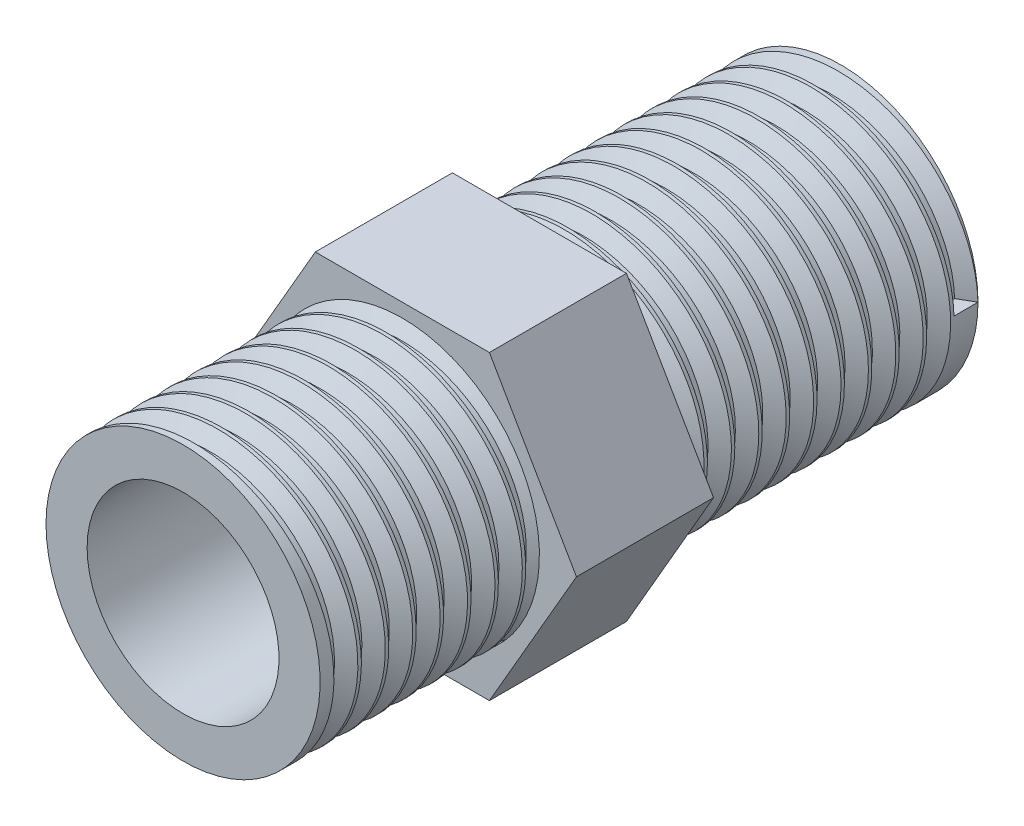
from build123d import *

# Parameters (mm, degrees)
BOSS_EXTRUDE1_DEPTH = 5
SKETCH6_R           = 5
BOSS_EXTRUDE2_DEPTH = 8
BOSS_EXTRUDE3_START = 11
SKETCH7_R           = 5
BOSS_EXTRUDE3_DEPTH = 11
SKETCH8_R           = 3.5
CUT_EXTRUDE2_DEPTH  = 26.428002936
THREAD1_PITCH       = 1
THREAD2_PITCH       = 1


with BuildPart() as part:
    # Sketch5 → Boss-Extrude1 (new body)
    with BuildSketch(Plane.XY):
        Polygon((6.350852961, 0), (3.175426481, 5.5), (-3.175426481, 5.5), (-6.350852961, 0), (-3.175426481, -5.5), (3.175426481, -5.5), align=None)
    extrude(amount=BOSS_EXTRUDE1_DEPTH)

    # Sketch6 → Boss-Extrude2 (add)
    with BuildSketch(Plane.XY.offset(5)):
        Circle(SKETCH6_R)
    extrude(amount=BOSS_EXTRUDE2_DEPTH)

    # Sketch7 → Boss-Extrude3 (add)
    with BuildSketch(Plane(origin=(0, 0, 0), x_dir=(-1, 0, 0), z_dir=(0, 0, -1)).offset(BOSS_EXTRUDE3_START)):
        with Locations(Location((0, 0, 0), (0, 0, 180))):
            Circle(SKETCH7_R)
    extrude(amount=-BOSS_EXTRUDE3_DEPTH)

    # Sketch8 → Cut-Extrude2 (cut, through all)
    with BuildSketch(Plane(origin=(0, 0, -11), x_dir=(-1, 0, 0), z_dir=(0, 0, -1))):
        Circle(SKETCH8_R)
    extrude(amount=-CUT_EXTRUDE2_DEPTH, mode=Mode.SUBTRACT)

    # Thread1: the profile of Thread Profile2 profile screwed along a right-hand helix of 8 turns, 8 arcs to a turn; built about Z, then put on its axis
    thread1_z = Axis((0, 0, 0), (0, 0, 1))
    thread1_corners = [(5.0003, 0, -0.000173205), (5.0003, 0, 0.875173202), (4.458734125, 0, 0.562499999), (4.458734125, 0, 0.312499999)]
    with BuildLine(mode=Mode.PRIVATE) as thread1_profile:
        Line(thread1_corners[0], thread1_corners[1])
        Line(thread1_corners[1], thread1_corners[2])
        Line(thread1_corners[2], thread1_corners[3])
        Line(thread1_corners[3], thread1_corners[0])
    thread1_cap = Face(thread1_profile.wire())
    thread1_turn_angles = [0, 22.5, 45, 67.5, 90, 112.5, 135, 157.5, 180, 202.5, 225, 247.5, 270, 292.5, 315, 337.5, 360]
    thread1_turn_weights = [1, 0.9238795325112867, 1, 0.9238795325112867, 1, 0.9238795325112867, 1, 0.9238795325112867, 1, 0.9238795325112867, 1, 0.9238795325112867, 1, 0.9238795325112867, 1, 0.9238795325112867, 1]
    thread1_turn_rails = [Edge.make_bspline([Vector(p[0], p[1], 0).rotate(thread1_z, thread1_turn_angles[k]) / thread1_turn_weights[k] + Vector(0, 0, p[2] + THREAD1_PITCH * thread1_turn_angles[k] / 360) for k in range(17)], [0, 0, 0, 1, 1, 2, 2, 3, 3, 4, 4, 5, 5, 6, 6, 7, 7, 8, 8, 8], 2, thread1_turn_weights) for p in thread1_corners]
    thread1_turn_sides = [Face.make_surface_from_curves(thread1_turn_rails[p[0]], thread1_turn_rails[p[1]]) for p in [(0, 1), (1, 2), (2, 3), (3, 0)]]
    thread1 = Plane(origin=(0, 0, 13), x_dir=(-1, 0, 0), z_dir=(0, 0, -1)) * Solid(Shell([*[p.moved(Location((0, 0, THREAD1_PITCH * i))) for i in range(8) for p in thread1_turn_sides], thread1_cap, thread1_cap.rotate(thread1_z, 2880).moved(Location((0, 0, THREAD1_PITCH * 2880 / 360)))]))
    add(thread1, mode=Mode.SUBTRACT)

    # Thread2: the profile of Thread Profile3 profile screwed along a right-hand helix of 11 turns, 8 arcs to a turn; built about Z, then put on its axis
    thread2_z = Axis((0, 0, 0), (0, 0, 1))
    thread2_corners = [(5.0003, 0, -0.000173205), (5.0003, 0, 0.875173202), (4.458734125, 0, 0.562499999), (4.458734125, 0, 0.312499999)]
    with BuildLine(mode=Mode.PRIVATE) as thread2_profile:
        Line(thread2_corners[0], thread2_corners[1])
        Line(thread2_corners[1], thread2_corners[2])
        Line(thread2_corners[2], thread2_corners[3])
        Line(thread2_corners[3], thread2_corners[0])
    thread2_cap = Face(thread2_profile.wire())
    thread2_turn_angles = [0, 22.5, 45, 67.5, 90, 112.5, 135, 157.5, 180, 202.5, 225, 247.5, 270, 292.5, 315, 337.5, 360]
    thread2_turn_weights = [1, 0.9238795325112867, 1, 0.9238795325112867, 1, 0.9238795325112867, 1, 0.9238795325112867, 1, 0.9238795325112867, 1, 0.9238795325112867, 1, 0.9238795325112867, 1, 0.9238795325112867, 1]
    thread2_turn_rails = [Edge.make_bspline([Vector(p[0], p[1], 0).rotate(thread2_z, thread2_turn_angles[k]) / thread2_turn_weights[k] + Vector(0, 0, p[2] + THREAD2_PITCH * thread2_turn_angles[k] / 360) for k in range(17)], [0, 0, 0, 1, 1, 2, 2, 3, 3, 4, 4, 5, 5, 6, 6, 7, 7, 8, 8, 8], 2, thread2_turn_weights) for p in thread2_corners]
    thread2_turn_sides = [Face.make_surface_from_curves(thread2_turn_rails[p[0]], thread2_turn_rails[p[1]]) for p in [(0, 1), (1, 2), (2, 3), (3, 0)]]
    thread2 = Plane(origin=(0, 0, -11), x_dir=(1, 0, 0), z_dir=(0, 0, 1)) * Solid(Shell([*[p.moved(Location((0, 0, THREAD2_PITCH * i))) for i in range(11) for p in thread2_turn_sides], thread2_cap, thread2_cap.rotate(thread2_z, 3960).moved(Location((0, 0, THREAD2_PITCH * 3960 / 360)))]))
    add(thread2, mode=Mode.SUBTRACT)


solid = part.part
